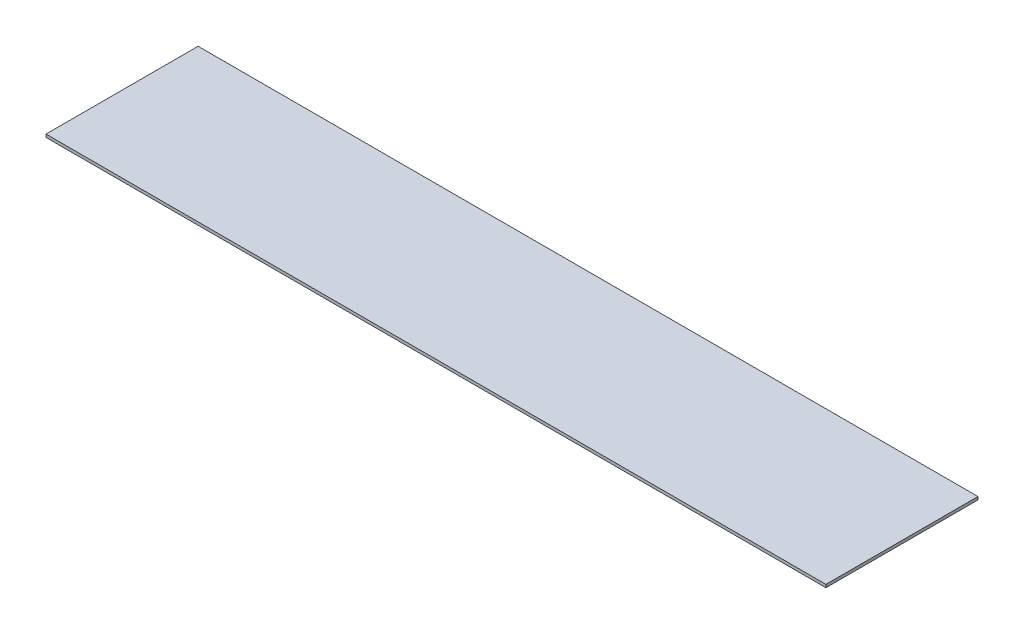
from build123d import *

# Parameters (mm, degrees)
SKETCH1_W           = 800
SKETCH1_H           = 156
BOSS_EXTRUDE1_DEPTH = 3


with BuildPart() as part:
    # Sketch1 → Boss-Extrude1 (new body)
    with BuildSketch(Plane(origin=(0, 0, 0), x_dir=(1, 0, 0), z_dir=(0, 1, 0))):
        with Locations((400, 78)):
            Rectangle(SKETCH1_W, SKETCH1_H)
    extrude(amount=BOSS_EXTRUDE1_DEPTH)


solid = part.part
